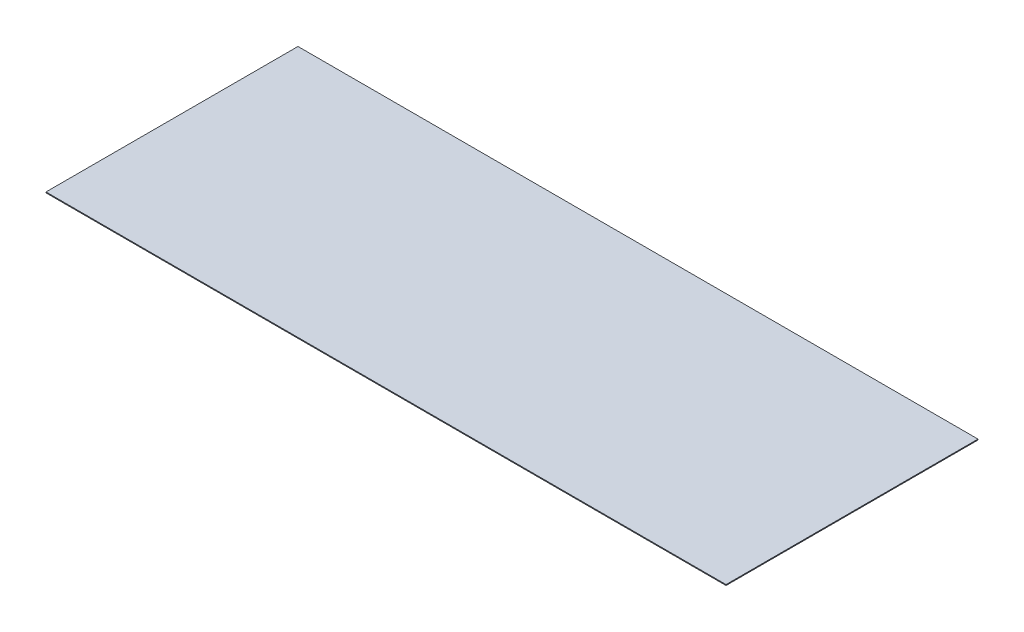
from build123d import *

# Parameters (mm, degrees)
SKETCH1_W           = 478.67
SKETCH1_H           = 177.36
BOSS_EXTRUDE1_DEPTH = 0.6096


with BuildPart() as part:
    # Sketch1 → Boss-Extrude1 (new body)
    with BuildSketch(Plane(origin=(0, 0, 0), x_dir=(1, 0, 0), z_dir=(0, 1, 0))):
        Rectangle(SKETCH1_W, SKETCH1_H)
    extrude(amount=BOSS_EXTRUDE1_DEPTH)


solid = part.part
